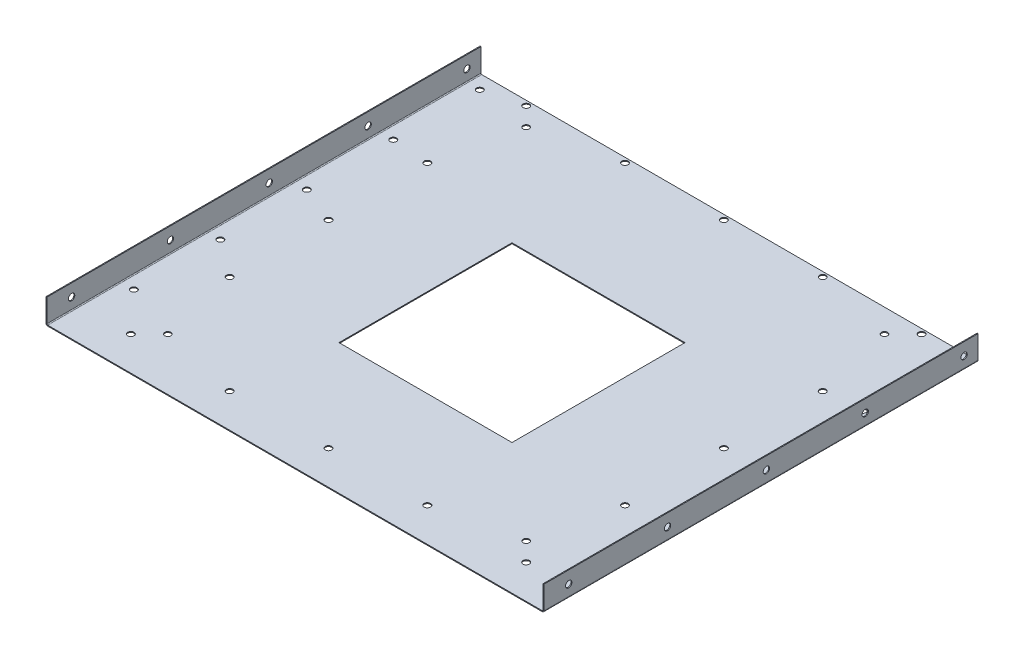
from build123d import *

# Parameters (mm, degrees)
SKETCH1_W                    = 510.0574
SKETCH1_H                    = 446.1002
BOSS_EXTRUDE1_DEPTH          = 0.9144
SKETCH6_W                    = 177.8
SKETCH6_H                    = 177.8
CUT_EXTRUDE1_DEPTH           = 0.9144
EDGE_FLANGE1_STRIP_W         = 5.4864
EDGE_FLANGE1_STRIP_H         = 0.9144
EDGE_FLANGE1_STRIP_CUT_DEPTH = 446.1002
EDGE_FLANGE1_DEPTH           = 446.1002
EDGE_FLANGE2_STRIP_W         = 5.4864
EDGE_FLANGE2_STRIP_H         = 0.9144
EDGE_FLANGE2_STRIP_CUT_DEPTH = 446.1002
EDGE_FLANGE2_DEPTH           = 446.1002
SKETCH13_R                   = 3.2639
CUT_EXTRUDE2_DEPTH           = 2.54
SKETCH17_R                   = 3.175
CUT_EXTRUDE5_DEPTH           = 12.7
SKETCH18_R                   = 3.2639
CUT_EXTRUDE6_DEPTH           = 12.7
SKETCH19_R                   = 3.2639
CUT_EXTRUDE7_DEPTH           = 559.94900381


# Sheet-metal steps are written as plain solids
with BuildPart() as part:
    # Sketch1 → Boss-Extrude1 (new body)
    with BuildSketch(Plane(origin=(0, 0, 0), x_dir=(1, 0, 0), z_dir=(0, 1, 0))):
        Rectangle(SKETCH1_W, SKETCH1_H)
    extrude(amount=BOSS_EXTRUDE1_DEPTH)

    # Sketch6 → Cut-Extrude1 (cut)
    with BuildSketch(Plane(origin=(0, 0.9144, 0), x_dir=(1, 0, 0), z_dir=(0, 1, 0))):
        Rectangle(SKETCH6_W, SKETCH6_H)
    extrude(amount=-CUT_EXTRUDE1_DEPTH, mode=Mode.SUBTRACT)

    # Edge-Flange1 strip (across the edge) → Edge-Flange1 strip cut (cut)
    with BuildSketch(Plane(origin=(255.0287, 0.9144, 223.0501), x_dir=(-1, 0, 0), z_dir=(0, 0, -1))):
        with Locations((-1.8288, -0.4572)):
            Rectangle(EDGE_FLANGE1_STRIP_W, EDGE_FLANGE1_STRIP_H)
    extrude(amount=EDGE_FLANGE1_STRIP_CUT_DEPTH, mode=Mode.SUBTRACT)

    # Edge-Flange1 section (across the edge) → Edge-Flange1 (add)
    with BuildSketch(Plane(origin=(255.0287, 0.9144, 223.0501), x_dir=(-1, 0, 0), z_dir=(0, 0, -1))):
        with BuildLine():
            Line((-0.9144, 0.9144), (-0.9144, 24.4856))
            Line((-0.9144, 24.4856), (0, 24.4856))
            Line((0, 24.4856), (0, 0.9144))
            ThreePointArc((0, 0.9144), (0.267821559, 0.267821559), (0.9144, 0))
            Line((0.9144, 0), (0.9144, -0.9144))
            ThreePointArc((0.9144, -0.9144), (-0.378756881, -0.378756881), (-0.9144, 0.9144))
        make_face()
    extrude(amount=EDGE_FLANGE1_DEPTH)

    # Edge-Flange2 strip (across the edge) → Edge-Flange2 strip cut (cut)
    with BuildSketch(Plane(origin=(-255.0287, 0.9144, -223.0501), x_dir=(1, 0, 0), z_dir=(0, 0, 1))):
        with Locations((-1.8288, -0.4572)):
            Rectangle(EDGE_FLANGE2_STRIP_W, EDGE_FLANGE2_STRIP_H)
    extrude(amount=EDGE_FLANGE2_STRIP_CUT_DEPTH, mode=Mode.SUBTRACT)

    # Edge-Flange2 section (across the edge) → Edge-Flange2 (add)
    with BuildSketch(Plane(origin=(-255.0287, 0.9144, -223.0501), x_dir=(1, 0, 0), z_dir=(0, 0, 1))):
        with BuildLine():
            Line((-0.9144, 0.9144), (-0.9144, 24.4856))
            Line((-0.9144, 24.4856), (0, 24.4856))
            Line((0, 24.4856), (0, 0.9144))
            ThreePointArc((0, 0.9144), (0.267821559, 0.267821559), (0.9144, 0))
            Line((0.9144, 0), (0.9144, -0.9144))
            ThreePointArc((0.9144, -0.9144), (-0.378756881, -0.378756881), (-0.9144, 0.9144))
        make_face()
    extrude(amount=EDGE_FLANGE2_DEPTH)

    # Sketch13 → Cut-Extrude2 (cut)
    with BuildSketch(Plane(origin=(0, 0, 0), x_dir=(-1, 0, 0), z_dir=(0, -1, 0))):
        with Locations(Location((241.6429, 208.5213, 0), (0, 0, 90))):
            Circle(SKETCH13_R)
        with Locations(Location((241.6429, 119.6213, 0), (0, 0, 90))):
            Circle(SKETCH13_R)
        with Locations(Location((241.6429, 30.7213, 0), (0, 0, 90))):
            Circle(SKETCH13_R)
        with Locations(Location((241.6429, -58.1787, 0), (0, 0, 90))):
            Circle(SKETCH13_R)
        with Locations(Location((241.6429, -147.0787, 0), (0, 0, 90))):
            Circle(SKETCH13_R)
        with Locations(Location((-240.9571, -147.0787, 0), (0, 0, 90))):
            Circle(SKETCH13_R)
        with Locations(Location((-240.9571, -58.1787, 0), (0, 0, 90))):
            Circle(SKETCH13_R)
        with Locations(Location((-240.9571, 30.7213, 0), (0, 0, 90))):
            Circle(SKETCH13_R)
        with Locations(Location((-240.9571, 119.6213, 0), (0, 0, 90))):
            Circle(SKETCH13_R)
        with Locations(Location((-240.9571, 208.5213, 0), (0, 0, 90))):
            Circle(SKETCH13_R)
    extrude(amount=-CUT_EXTRUDE2_DEPTH, mode=Mode.SUBTRACT)

    # Sketch17 → Cut-Extrude5 (cut)
    with BuildSketch(Plane.XZ.offset(4.7498)):
        with Locations(Location((-184.4929, 169.2148, 0), (0, 0, 270))):
            Circle(SKETCH17_R)
        with Locations(Location((183.8071, 169.2148, 0), (0, 0, 270))):
            Circle(SKETCH17_R)
        with Locations(Location((183.8071, -199.0852, 0), (0, 0, 270))):
            Circle(SKETCH17_R)
        with Locations(Location((-184.4929, -199.0852, 0), (0, 0, 270))):
            Circle(SKETCH17_R)
    extrude(amount=-CUT_EXTRUDE5_DEPTH, mode=Mode.SUBTRACT)

    # Sketch18 → Cut-Extrude6 (cut)
    with BuildSketch(Plane(origin=(0, 0.9144, 0), x_dir=(1, 0, 0), z_dir=(0, 1, 0))):
        with Locations(Location((-203.5429, -188.2648, 0), (0, 0, 270))):
            Circle(SKETCH18_R)
        with Locations(Location((202.8571, 218.1352, 0), (0, 0, 270))):
            Circle(SKETCH18_R)
        with Locations(Location((-101.9429, -188.2648, 0), (0, 0, 270))):
            Circle(SKETCH18_R)
        with Locations(Location((-0.3429, -188.2648, 0), (0, 0, 270))):
            Circle(SKETCH18_R)
        with Locations(Location((101.2571, -188.2648, 0), (0, 0, 270))):
            Circle(SKETCH18_R)
        with Locations(Location((202.8571, -188.2648, 0), (0, 0, 270))):
            Circle(SKETCH18_R)
        with Locations(Location((-203.5429, -86.6648, 0), (0, 0, 270))):
            Circle(SKETCH18_R)
        with Locations(Location((-203.5429, 14.9352, 0), (0, 0, 270))):
            Circle(SKETCH18_R)
        with Locations(Location((-203.5429, 116.5352, 0), (0, 0, 270))):
            Circle(SKETCH18_R)
        with Locations((-203.5429, -289.8648)):
            Circle(SKETCH18_R)
        with Locations(Location((202.8571, 116.5352, 0), (0, 0, 270))):
            Circle(SKETCH18_R)
        with Locations((-203.5429, -391.4648)):
            Circle(SKETCH18_R)
        with Locations(Location((202.8571, 14.9352, 0), (0, 0, 270))):
            Circle(SKETCH18_R)
        with Locations((-203.5429, -493.0648)):
            Circle(SKETCH18_R)
        with Locations(Location((202.8571, -86.6648, 0), (0, 0, 270))):
            Circle(SKETCH18_R)
        with Locations((-305.1429, -188.2648)):
            Circle(SKETCH18_R)
        with Locations(Location((101.2571, 218.1352, 0), (0, 0, 270))):
            Circle(SKETCH18_R)
        with Locations((-406.7429, -188.2648)):
            Circle(SKETCH18_R)
        with Locations(Location((-0.3429, 218.1352, 0), (0, 0, 270))):
            Circle(SKETCH18_R)
        with Locations((-508.3429, -188.2648)):
            Circle(SKETCH18_R)
        with Locations(Location((-101.9429, 218.1352, 0), (0, 0, 270))):
            Circle(SKETCH18_R)
        with Locations((-609.9429, -188.2648)):
            Circle(SKETCH18_R)
        with Locations(Location((-203.5429, 218.1352, 0), (0, 0, 270))):
            Circle(SKETCH18_R)
    extrude(amount=-CUT_EXTRUDE6_DEPTH, mode=Mode.SUBTRACT)

    # Sketch19 → Cut-Extrude7 (cut, through all)
    with BuildSketch(Plane(origin=(255.9431, 0, 0), x_dir=(0, 0, -1), z_dir=(1, 0, 0))):
        with Locations(Location((-197.6501, 12.7, 0), (0, 0, 90))):
            Circle(SKETCH19_R)
        with Locations(Location((-96.0501, 12.7, 0), (0, 0, 90))):
            Circle(SKETCH19_R)
        with Locations(Location((5.5499, 12.7, 0), (0, 0, 90))):
            Circle(SKETCH19_R)
        with Locations(Location((107.1499, 12.7, 0), (0, 0, 90))):
            Circle(SKETCH19_R)
        with Locations(Location((208.7499, 12.7, 0), (0, 0, 90))):
            Circle(SKETCH19_R)
    extrude(amount=-CUT_EXTRUDE7_DEPTH, mode=Mode.SUBTRACT)


solid = part.part
